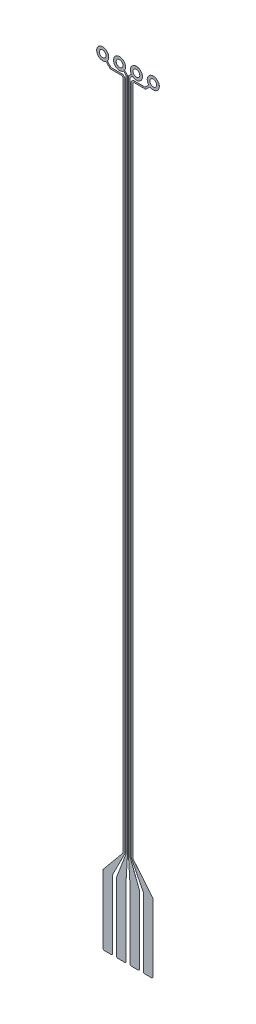
from build123d import *

# Parameters (mm, degrees)
BOSS_EXTRUDE1_DEPTH   = 0.001
BOSS_EXTRUDE1_2_DEPTH = 0.001
BOSS_EXTRUDE1_3_DEPTH = 0.001
BOSS_EXTRUDE1_4_DEPTH = 0.001


with BuildPart() as part:
    # Model → Boss-Extrude1 (new body)
    with BuildSketch(Plane.XY):
        Polygon((-0.925, -28.446), (-0.92475, -28.451), (-0.924, -28.45575), (-0.923, -28.4605), (-0.92125, -28.46525), (-0.919, -28.4695), (-0.9165, -28.47375), (-0.91375, -28.47775), (-0.9105, -28.4815), (-0.90675, -28.48475), (-0.90275, -28.4875), (-0.8985, -28.49), (-0.89425, -28.49225), (-0.8895, -28.494), (-0.88475, -28.495), (-0.88, -28.49575), (-0.875, -28.496), (-0.625, -28.496), (-0.62, -28.49575), (-0.61525, -28.495), (-0.6105, -28.494), (-0.60575, -28.49225), (-0.6015, -28.49), (-0.59725, -28.4875), (-0.59325, -28.48475), (-0.5895, -28.4815), (-0.58625, -28.47775), (-0.5835, -28.47375), (-0.581, -28.4695), (-0.57875, -28.46525), (-0.577, -28.4605), (-0.576, -28.45575), (-0.57525, -28.451), (-0.575, -28.446), (-0.575, -25.896), (-0.12, -24.996), (-0.12, 0.042426), (-0.192574, 0.115), (-0.632574, 0.115), (-0.771201, 0.253626), (-0.768, 0.2575), (-0.7635, 0.26325), (-0.75925, 0.26875), (-0.755, 0.275), (-0.751, 0.28125), (-0.74725, 0.2875), (-0.74375, 0.29375), (-0.74025, 0.3005), (-0.73725, 0.307), (-0.73425, 0.31375), (-0.7315, 0.32075), (-0.729, 0.32775), (-0.72675, 0.3345), (-0.72475, 0.34175), (-0.723, 0.34875), (-0.7215, 0.356), (-0.72, 0.3635), (-0.719, 0.3705), (-0.71825, 0.37775), (-0.7175, 0.38525), (-0.71725, 0.3925), (-0.717, 0.4), (-0.71725, 0.4075), (-0.7175, 0.41475), (-0.71825, 0.42225), (-0.719, 0.4295), (-0.72, 0.4365), (-0.7215, 0.444), (-0.723, 0.45125), (-0.72475, 0.45825), (-0.72675, 0.4655), (-0.729, 0.47225), (-0.7315, 0.47925), (-0.73425, 0.48625), (-0.73725, 0.493), (-0.74025, 0.4995), (-0.74375, 0.50625), (-0.74725, 0.5125), (-0.751, 0.51875), (-0.755, 0.525), (-0.75925, 0.53125), (-0.7635, 0.53675), (-0.768, 0.5425), (-0.77275, 0.54825), (-0.77775, 0.55375), (-0.78825, 0.56425), (-0.79375, 0.56925), (-0.7995, 0.574), (-0.80525, 0.5785), (-0.81075, 0.58275), (-0.817, 0.587), (-0.82325, 0.591), (-0.8295, 0.59475), (-0.83575, 0.59825), (-0.8425, 0.60175), (-0.849, 0.60475), (-0.85575, 0.60775), (-0.86275, 0.6105), (-0.86975, 0.613), (-0.8765, 0.61525), (-0.88375, 0.61725), (-0.89075, 0.619), (-0.898, 0.6205), (-0.9055, 0.622), (-0.9125, 0.623), (-0.91975, 0.62375), (-0.92725, 0.6245), (-0.9345, 0.62475), (-0.942, 0.625), (-0.9495, 0.62475), (-0.95675, 0.6245), (-0.96425, 0.62375), (-0.9715, 0.623), (-0.9785, 0.622), (-0.986, 0.6205), (-0.99325, 0.619), (-1.00025, 0.61725), (-1.0075, 0.61525), (-1.01425, 0.613), (-1.02125, 0.6105), (-1.02825, 0.60775), (-1.035, 0.60475), (-1.041, 0.601981), (-1.04825, 0.59825), (-1.0545, 0.59475), (-1.06075, 0.591), (-1.067, 0.587), (-1.07325, 0.58275), (-1.07875, 0.5785), (-1.0845, 0.574), (-1.09025, 0.56925), (-1.09575, 0.56425), (-1.10625, 0.55375), (-1.11125, 0.54825), (-1.116, 0.5425), (-1.1205, 0.53675), (-1.12475, 0.53125), (-1.129, 0.525), (-1.133, 0.51875), (-1.13675, 0.5125), (-1.14025, 0.50625), (-1.14375, 0.4995), (-1.14675, 0.493), (-1.14975, 0.48625), (-1.1525, 0.47925), (-1.155, 0.47225), (-1.15725, 0.4655), (-1.15925, 0.45825), (-1.161, 0.45125), (-1.1625, 0.444), (-1.164, 0.4365), (-1.165, 0.4295), (-1.16575, 0.42225), (-1.1665, 0.41475), (-1.16675, 0.4075), (-1.167, 0.4), (-1.16675, 0.3925), (-1.1665, 0.38525), (-1.16575, 0.37775), (-1.165, 0.3705), (-1.164, 0.3635), (-1.1625, 0.356), (-1.161, 0.34875), (-1.15925, 0.34175), (-1.15725, 0.3345), (-1.155, 0.32775), (-1.1525, 0.32075), (-1.14975, 0.31375), (-1.14675, 0.307), (-1.14375, 0.3005), (-1.14025, 0.29375), (-1.13675, 0.2875), (-1.133, 0.28125), (-1.129, 0.275), (-1.12475, 0.26875), (-1.1205, 0.26325), (-1.116, 0.2575), (-1.11125, 0.25175), (-1.10625, 0.24625), (-1.09575, 0.23575), (-1.09025, 0.23075), (-1.0845, 0.226), (-1.07875, 0.2215), (-1.07325, 0.21725), (-1.067, 0.213), (-1.06075, 0.209), (-1.0545, 0.20525), (-1.04825, 0.20175), (-1.0415, 0.19825), (-1.035, 0.19525), (-1.02825, 0.19225), (-1.02125, 0.1895), (-1.01425, 0.187), (-1.0075, 0.18475), (-1.00025, 0.18275), (-0.99325, 0.181), (-0.986, 0.1795), (-0.9785, 0.178), (-0.9715, 0.177), (-0.96425, 0.17625), (-0.95675, 0.1755), (-0.9495, 0.17525), (-0.942, 0.175), (-0.9345, 0.17525), (-0.92725, 0.1755), (-0.91975, 0.17625), (-0.9125, 0.177), (-0.9055, 0.178), (-0.898, 0.1795), (-0.89075, 0.181), (-0.88375, 0.18275), (-0.8765, 0.18475), (-0.86975, 0.187), (-0.86275, 0.1895), (-0.85575, 0.19225), (-0.849, 0.19525), (-0.8425, 0.19825), (-0.83575, 0.20175), (-0.8295, 0.20525), (-0.82325, 0.209), (-0.817, 0.213), (-0.816064, 0.213637), (-0.657426, 0.055), (-0.217426, 0.055), (-0.18, 0.017574), (-0.18, -24.996), (-0.925, -25.896), align=None)
        Polygon((-1.041, 0.47625), (-1.03775, 0.48025), (-1.03425, 0.48425), (-1.0305, 0.48825), (-1.02625, 0.49225), (-1.02225, 0.49575), (-1.01825, 0.499), (-1.0135, 0.5025), (-1.009, 0.5055), (-1.0045, 0.50825), (-0.99975, 0.51075), (-0.99475, 0.51325), (-0.98975, 0.5155), (-0.985, 0.51725), (-0.97975, 0.519), (-0.97425, 0.52075), (-0.969, 0.522), (-0.96375, 0.523), (-0.9585, 0.52375), (-0.953, 0.5245), (-0.942, 0.525), (-0.931, 0.5245), (-0.9255, 0.52375), (-0.92025, 0.523), (-0.915, 0.522), (-0.90975, 0.52075), (-0.90425, 0.519), (-0.899, 0.51725), (-0.89425, 0.5155), (-0.88925, 0.51325), (-0.88425, 0.51075), (-0.8795, 0.50825), (-0.875, 0.5055), (-0.8705, 0.5025), (-0.86575, 0.499), (-0.86175, 0.49575), (-0.85775, 0.49225), (-0.8535, 0.48825), (-0.84975, 0.48425), (-0.84625, 0.48025), (-0.843, 0.47625), (-0.8395, 0.4715), (-0.8365, 0.467), (-0.83375, 0.4625), (-0.83125, 0.45775), (-0.82875, 0.45275), (-0.8265, 0.44775), (-0.82475, 0.443), (-0.823, 0.43775), (-0.82125, 0.43225), (-0.82, 0.427), (-0.819, 0.42175), (-0.81825, 0.4165), (-0.8175, 0.411), (-0.817, 0.4), (-0.8175, 0.389), (-0.81825, 0.3835), (-0.819, 0.37825), (-0.82, 0.373), (-0.82125, 0.36775), (-0.823, 0.36225), (-0.82475, 0.357), (-0.8265, 0.35225), (-0.82875, 0.34725), (-0.83125, 0.34225), (-0.83375, 0.3375), (-0.8365, 0.333), (-0.8395, 0.3285), (-0.843, 0.32375), (-0.84625, 0.31975), (-0.84975, 0.31575), (-0.8535, 0.31175), (-0.85775, 0.30775), (-0.86175, 0.30425), (-0.86575, 0.301), (-0.8705, 0.2975), (-0.875, 0.2945), (-0.8795, 0.29175), (-0.88425, 0.28925), (-0.88925, 0.28675), (-0.89425, 0.2845), (-0.899, 0.28275), (-0.90425, 0.281), (-0.90975, 0.27925), (-0.915, 0.278), (-0.92025, 0.277), (-0.9255, 0.27625), (-0.931, 0.2755), (-0.942, 0.275), (-0.953, 0.2755), (-0.9585, 0.27625), (-0.96375, 0.277), (-0.969, 0.278), (-0.97425, 0.27925), (-0.97975, 0.281), (-0.985, 0.28275), (-0.98975, 0.2845), (-0.99475, 0.28675), (-0.99975, 0.28925), (-1.0045, 0.29175), (-1.009, 0.2945), (-1.0135, 0.2975), (-1.01825, 0.301), (-1.02225, 0.30425), (-1.02625, 0.30775), (-1.0305, 0.31175), (-1.03425, 0.31575), (-1.03775, 0.31975), (-1.041, 0.32375), (-1.0445, 0.3285), (-1.0475, 0.333), (-1.05025, 0.3375), (-1.05275, 0.34225), (-1.05525, 0.34725), (-1.0575, 0.35225), (-1.05925, 0.357), (-1.061, 0.36225), (-1.06275, 0.36775), (-1.064, 0.373), (-1.065, 0.37825), (-1.06575, 0.3835), (-1.0665, 0.389), (-1.067, 0.4), (-1.0665, 0.411), (-1.06575, 0.4165), (-1.065, 0.42175), (-1.064, 0.427), (-1.06275, 0.43225), (-1.061, 0.43775), (-1.05925, 0.443), (-1.0575, 0.44775), (-1.05525, 0.45275), (-1.05275, 0.45775), (-1.05025, 0.4625), (-1.0475, 0.467), (-1.0445, 0.4715), align=None, mode=Mode.SUBTRACT)
    extrude(amount=BOSS_EXTRUDE1_DEPTH)


with BuildPart() as body_2:
    # Model → Boss-Extrude1 2 (new body)
    with BuildSketch(Plane.XY):
        Polygon((-0.02, -24.996), (-0.02, 0.172426), (-0.125273, 0.277699), (-0.123, 0.28125), (-0.11925, 0.2875), (-0.11575, 0.29375), (-0.11225, 0.3005), (-0.10925, 0.307), (-0.10625, 0.31375), (-0.1035, 0.32075), (-0.101, 0.32775), (-0.09875, 0.3345), (-0.09675, 0.34175), (-0.095, 0.34875), (-0.0935, 0.356), (-0.092, 0.3635), (-0.091, 0.3705), (-0.09025, 0.37775), (-0.0895, 0.38525), (-0.08925, 0.3925), (-0.089, 0.4), (-0.08925, 0.4075), (-0.0895, 0.41475), (-0.09025, 0.42225), (-0.091, 0.4295), (-0.092, 0.4365), (-0.0935, 0.444), (-0.095, 0.45125), (-0.09675, 0.45825), (-0.09875, 0.4655), (-0.101, 0.47225), (-0.1035, 0.47925), (-0.10625, 0.48625), (-0.10925, 0.493), (-0.11225, 0.4995), (-0.11575, 0.50625), (-0.11925, 0.5125), (-0.123, 0.51875), (-0.127, 0.525), (-0.13125, 0.53125), (-0.1355, 0.53675), (-0.14, 0.5425), (-0.14475, 0.54825), (-0.14975, 0.55375), (-0.16025, 0.56425), (-0.16575, 0.56925), (-0.1715, 0.574), (-0.17725, 0.5785), (-0.18275, 0.58275), (-0.189, 0.587), (-0.19525, 0.591), (-0.2015, 0.59475), (-0.20775, 0.59825), (-0.2145, 0.60175), (-0.221, 0.60475), (-0.22775, 0.60775), (-0.23475, 0.6105), (-0.24175, 0.613), (-0.2485, 0.61525), (-0.25575, 0.61725), (-0.26275, 0.619), (-0.27, 0.6205), (-0.2775, 0.622), (-0.2845, 0.623), (-0.29175, 0.62375), (-0.29925, 0.6245), (-0.3065, 0.62475), (-0.314, 0.625), (-0.3215, 0.62475), (-0.32875, 0.6245), (-0.33625, 0.62375), (-0.3435, 0.623), (-0.3505, 0.622), (-0.358, 0.6205), (-0.36525, 0.619), (-0.37225, 0.61725), (-0.3795, 0.61525), (-0.38625, 0.613), (-0.39325, 0.6105), (-0.40025, 0.60775), (-0.407, 0.60475), (-0.4135, 0.60175), (-0.42025, 0.59825), (-0.4265, 0.59475), (-0.43275, 0.591), (-0.4385, 0.58732), (-0.44525, 0.58275), (-0.45075, 0.5785), (-0.4565, 0.574), (-0.46225, 0.56925), (-0.46775, 0.56425), (-0.47825, 0.55375), (-0.48325, 0.54825), (-0.488, 0.5425), (-0.4925, 0.53675), (-0.49675, 0.53125), (-0.501, 0.525), (-0.505, 0.51875), (-0.50875, 0.5125), (-0.51225, 0.50625), (-0.51575, 0.4995), (-0.51875, 0.493), (-0.52175, 0.48625), (-0.5245, 0.47925), (-0.527, 0.47225), (-0.52925, 0.4655), (-0.53125, 0.45825), (-0.533, 0.45125), (-0.5345, 0.444), (-0.536, 0.4365), (-0.537, 0.4295), (-0.53775, 0.42225), (-0.5385, 0.41475), (-0.53875, 0.4075), (-0.539, 0.4), (-0.53875, 0.3925), (-0.5385, 0.38525), (-0.53775, 0.37775), (-0.537, 0.3705), (-0.536, 0.3635), (-0.5345, 0.356), (-0.533, 0.34875), (-0.53125, 0.34175), (-0.52925, 0.3345), (-0.527, 0.32775), (-0.5245, 0.32075), (-0.52175, 0.31375), (-0.51875, 0.307), (-0.51575, 0.3005), (-0.51225, 0.29375), (-0.50875, 0.2875), (-0.505, 0.28125), (-0.501, 0.275), (-0.49675, 0.26875), (-0.4925, 0.26325), (-0.488, 0.2575), (-0.48325, 0.25175), (-0.47825, 0.24625), (-0.46775, 0.23575), (-0.46225, 0.23075), (-0.4565, 0.226), (-0.45075, 0.2215), (-0.44525, 0.21725), (-0.439, 0.213), (-0.43275, 0.209), (-0.4265, 0.20525), (-0.42025, 0.20175), (-0.4135, 0.19825), (-0.407, 0.19525), (-0.40025, 0.19225), (-0.39325, 0.1895), (-0.38625, 0.187), (-0.3795, 0.18475), (-0.37225, 0.18275), (-0.36525, 0.181), (-0.358, 0.1795), (-0.3505, 0.178), (-0.3435, 0.177), (-0.33625, 0.17625), (-0.32875, 0.1755), (-0.3215, 0.17525), (-0.314, 0.175), (-0.3065, 0.17525), (-0.29925, 0.1755), (-0.29175, 0.17625), (-0.2845, 0.177), (-0.2775, 0.178), (-0.27, 0.1795), (-0.26275, 0.181), (-0.25575, 0.18275), (-0.2485, 0.18475), (-0.24175, 0.187), (-0.23475, 0.1895), (-0.22775, 0.19225), (-0.221, 0.19525), (-0.2145, 0.19825), (-0.20775, 0.20175), (-0.2015, 0.20525), (-0.19525, 0.209), (-0.189, 0.213), (-0.18275, 0.21725), (-0.17725, 0.2215), (-0.1715, 0.226), (-0.16575, 0.23075), (-0.164402, 0.231976), (-0.08, 0.147574), (-0.08, -24.996), (-0.425, -25.896), (-0.425, -28.446), (-0.42475, -28.451), (-0.424, -28.45575), (-0.423, -28.4605), (-0.42125, -28.46525), (-0.419, -28.4695), (-0.4165, -28.47375), (-0.41375, -28.47775), (-0.4105, -28.4815), (-0.40675, -28.48475), (-0.40275, -28.4875), (-0.3985, -28.49), (-0.39425, -28.49225), (-0.3895, -28.494), (-0.38475, -28.495), (-0.38, -28.49575), (-0.375, -28.496), (-0.125, -28.496), (-0.12, -28.49575), (-0.11525, -28.495), (-0.1105, -28.494), (-0.10575, -28.49225), (-0.1015, -28.49), (-0.09725, -28.4875), (-0.09325, -28.48475), (-0.0895, -28.4815), (-0.08625, -28.47775), (-0.0835, -28.47375), (-0.081, -28.4695), (-0.07875, -28.46525), (-0.077, -28.4605), (-0.076, -28.45575), (-0.07525, -28.451), (-0.075, -28.446), (-0.075, -25.896), align=None)
        Polygon((-0.4385, 0.411), (-0.43775, 0.4165), (-0.437, 0.42175), (-0.436, 0.427), (-0.43475, 0.43225), (-0.433, 0.43775), (-0.43125, 0.443), (-0.4295, 0.44775), (-0.42725, 0.45275), (-0.42475, 0.45775), (-0.42225, 0.4625), (-0.4195, 0.467), (-0.4165, 0.4715), (-0.413, 0.47625), (-0.40975, 0.48025), (-0.40625, 0.48425), (-0.4025, 0.48825), (-0.39825, 0.49225), (-0.39425, 0.49575), (-0.39025, 0.499), (-0.3855, 0.5025), (-0.381, 0.5055), (-0.3765, 0.50825), (-0.37175, 0.51075), (-0.36675, 0.51325), (-0.36175, 0.5155), (-0.357, 0.51725), (-0.35175, 0.519), (-0.34625, 0.52075), (-0.341, 0.522), (-0.33575, 0.523), (-0.3305, 0.52375), (-0.325, 0.5245), (-0.314, 0.525), (-0.303, 0.5245), (-0.2975, 0.52375), (-0.29225, 0.523), (-0.287, 0.522), (-0.28175, 0.52075), (-0.27625, 0.519), (-0.271, 0.51725), (-0.26625, 0.5155), (-0.26125, 0.51325), (-0.25625, 0.51075), (-0.2515, 0.50825), (-0.247, 0.5055), (-0.2425, 0.5025), (-0.23775, 0.499), (-0.23375, 0.49575), (-0.22975, 0.49225), (-0.2255, 0.48825), (-0.22175, 0.48425), (-0.21825, 0.48025), (-0.215, 0.47625), (-0.2115, 0.4715), (-0.2085, 0.467), (-0.20575, 0.4625), (-0.20325, 0.45775), (-0.20075, 0.45275), (-0.1985, 0.44775), (-0.19675, 0.443), (-0.195, 0.43775), (-0.19325, 0.43225), (-0.192, 0.427), (-0.191, 0.42175), (-0.19025, 0.4165), (-0.1895, 0.411), (-0.189, 0.4), (-0.1895, 0.389), (-0.19025, 0.3835), (-0.191, 0.37825), (-0.192, 0.373), (-0.19325, 0.36775), (-0.195, 0.36225), (-0.19675, 0.357), (-0.1985, 0.35225), (-0.20075, 0.34725), (-0.20325, 0.34225), (-0.20575, 0.3375), (-0.2085, 0.333), (-0.2115, 0.3285), (-0.215, 0.32375), (-0.21825, 0.31975), (-0.22175, 0.31575), (-0.2255, 0.31175), (-0.22975, 0.30775), (-0.23375, 0.30425), (-0.23775, 0.301), (-0.2425, 0.2975), (-0.247, 0.2945), (-0.2515, 0.29175), (-0.25625, 0.28925), (-0.26125, 0.28675), (-0.26625, 0.2845), (-0.271, 0.28275), (-0.27625, 0.281), (-0.28175, 0.27925), (-0.287, 0.278), (-0.29225, 0.277), (-0.2975, 0.27625), (-0.303, 0.2755), (-0.314, 0.275), (-0.325, 0.2755), (-0.3305, 0.27625), (-0.33575, 0.277), (-0.341, 0.278), (-0.34625, 0.27925), (-0.35175, 0.281), (-0.357, 0.28275), (-0.36175, 0.2845), (-0.36675, 0.28675), (-0.37175, 0.28925), (-0.3765, 0.29175), (-0.381, 0.2945), (-0.3855, 0.2975), (-0.39025, 0.301), (-0.39425, 0.30425), (-0.39825, 0.30775), (-0.4025, 0.31175), (-0.40625, 0.31575), (-0.40975, 0.31975), (-0.413, 0.32375), (-0.4165, 0.3285), (-0.4195, 0.333), (-0.42225, 0.3375), (-0.42475, 0.34225), (-0.42725, 0.34725), (-0.4295, 0.35225), (-0.43125, 0.357), (-0.433, 0.36225), (-0.43475, 0.36775), (-0.436, 0.373), (-0.437, 0.37825), (-0.43775, 0.3835), (-0.4385, 0.389), (-0.439, 0.4), align=None, mode=Mode.SUBTRACT)
    extrude(amount=BOSS_EXTRUDE1_2_DEPTH)


with BuildPart() as body_3:
    # Model → Boss-Extrude1 3 (new body)
    with BuildSketch(Plane.XY):
        Polygon((0.08, -24.996), (0.08, 0.145), (0.16575, 0.23075), (0.1715, 0.226), (0.17725, 0.2215), (0.18275, 0.21725), (0.189, 0.213), (0.19525, 0.209), (0.2015, 0.20525), (0.20775, 0.20175), (0.2145, 0.19825), (0.221, 0.19525), (0.22775, 0.19225), (0.23475, 0.1895), (0.24175, 0.187), (0.2485, 0.18475), (0.25575, 0.18275), (0.26275, 0.181), (0.27, 0.1795), (0.2775, 0.178), (0.2845, 0.177), (0.29175, 0.17625), (0.29925, 0.1755), (0.3065, 0.17525), (0.314, 0.175), (0.3215, 0.17525), (0.32875, 0.1755), (0.33625, 0.17625), (0.3435, 0.177), (0.3505, 0.178), (0.358, 0.1795), (0.36525, 0.181), (0.37225, 0.18275), (0.3795, 0.18475), (0.38625, 0.187), (0.39325, 0.1895), (0.40025, 0.19225), (0.407, 0.19525), (0.4135, 0.19825), (0.42025, 0.20175), (0.4265, 0.20525), (0.43275, 0.209), (0.439, 0.213), (0.44525, 0.21725), (0.45075, 0.2215), (0.4565, 0.226), (0.46225, 0.23075), (0.46775, 0.23575), (0.47825, 0.24625), (0.48325, 0.25175), (0.488, 0.2575), (0.4925, 0.26325), (0.49675, 0.26875), (0.501, 0.275), (0.505, 0.28125), (0.50875, 0.2875), (0.51225, 0.29375), (0.51575, 0.3005), (0.51875, 0.307), (0.52175, 0.31375), (0.5245, 0.32075), (0.527, 0.32775), (0.52925, 0.3345), (0.53125, 0.34175), (0.533, 0.34875), (0.5345, 0.356), (0.536, 0.3635), (0.537, 0.3705), (0.53775, 0.37775), (0.5385, 0.38525), (0.53875, 0.3925), (0.539, 0.4), (0.53875, 0.4075), (0.5385, 0.41475), (0.53775, 0.42225), (0.537, 0.4295), (0.536, 0.4365), (0.5345, 0.444), (0.533, 0.45125), (0.53125, 0.45825), (0.52925, 0.4655), (0.527, 0.47225), (0.5245, 0.47925), (0.52175, 0.48625), (0.51875, 0.493), (0.51575, 0.4995), (0.51225, 0.50625), (0.50875, 0.5125), (0.505, 0.51875), (0.501, 0.525), (0.49675, 0.53125), (0.4925, 0.53675), (0.488, 0.5425), (0.48325, 0.54825), (0.47825, 0.55375), (0.46775, 0.56425), (0.46225, 0.56925), (0.4565, 0.574), (0.45075, 0.5785), (0.44525, 0.58275), (0.439, 0.587), (0.43275, 0.591), (0.4265, 0.59475), (0.42025, 0.59825), (0.4135, 0.60175), (0.407, 0.60475), (0.40025, 0.60775), (0.39325, 0.6105), (0.38625, 0.613), (0.3795, 0.61525), (0.37225, 0.61725), (0.36525, 0.619), (0.358, 0.6205), (0.3505, 0.622), (0.3435, 0.623), (0.33625, 0.62375), (0.32875, 0.6245), (0.3215, 0.62475), (0.314, 0.625), (0.3065, 0.62475), (0.29925, 0.6245), (0.29175, 0.62375), (0.2845, 0.623), (0.2775, 0.622), (0.27, 0.6205), (0.26275, 0.619), (0.25575, 0.61725), (0.2485, 0.61525), (0.24175, 0.613), (0.23475, 0.6105), (0.22775, 0.60775), (0.221, 0.60475), (0.2145, 0.60175), (0.20775, 0.59825), (0.2015, 0.59475), (0.19525, 0.591), (0.1895, 0.58732), (0.18275, 0.58275), (0.17725, 0.5785), (0.1715, 0.574), (0.16575, 0.56925), (0.16025, 0.56425), (0.14975, 0.55375), (0.14475, 0.54825), (0.14, 0.5425), (0.1355, 0.53675), (0.13125, 0.53125), (0.127, 0.525), (0.123, 0.51875), (0.11925, 0.5125), (0.11575, 0.50625), (0.11225, 0.4995), (0.10925, 0.493), (0.10625, 0.48625), (0.1035, 0.47925), (0.101, 0.47225), (0.09875, 0.4655), (0.09675, 0.45825), (0.095, 0.45125), (0.0935, 0.444), (0.092, 0.4365), (0.091, 0.4295), (0.09025, 0.42225), (0.0895, 0.41475), (0.08925, 0.4075), (0.089, 0.4), (0.08925, 0.3925), (0.0895, 0.38525), (0.09025, 0.37775), (0.091, 0.3705), (0.092, 0.3635), (0.0935, 0.356), (0.095, 0.34875), (0.09675, 0.34175), (0.09875, 0.3345), (0.101, 0.32775), (0.1035, 0.32075), (0.10625, 0.31375), (0.10925, 0.307), (0.11225, 0.3005), (0.11575, 0.29375), (0.11925, 0.2875), (0.123, 0.28125), (0.126277, 0.276129), (0.02, 0.169852), (0.02, -24.996), (0.075, -25.896), (0.075, -28.446), (0.07525, -28.451), (0.076, -28.45575), (0.077, -28.4605), (0.07875, -28.46525), (0.081, -28.4695), (0.0835, -28.47375), (0.08625, -28.47775), (0.0895, -28.4815), (0.09325, -28.48475), (0.09725, -28.4875), (0.1015, -28.49), (0.10575, -28.49225), (0.1105, -28.494), (0.11525, -28.495), (0.12, -28.49575), (0.125, -28.496), (0.375, -28.496), (0.38, -28.49575), (0.38475, -28.495), (0.3895, -28.494), (0.39425, -28.49225), (0.3985, -28.49), (0.40275, -28.4875), (0.40675, -28.48475), (0.4105, -28.4815), (0.41375, -28.47775), (0.4165, -28.47375), (0.419, -28.4695), (0.42125, -28.46525), (0.423, -28.4605), (0.424, -28.45575), (0.42475, -28.451), (0.425, -28.446), (0.425, -25.896), align=None)
        Polygon((0.1895, 0.411), (0.19025, 0.4165), (0.191, 0.42175), (0.192, 0.427), (0.19325, 0.43225), (0.195, 0.43775), (0.19675, 0.443), (0.1985, 0.44775), (0.20075, 0.45275), (0.20325, 0.45775), (0.20575, 0.4625), (0.2085, 0.467), (0.2115, 0.4715), (0.215, 0.47625), (0.21825, 0.48025), (0.22175, 0.48425), (0.2255, 0.48825), (0.22975, 0.49225), (0.23375, 0.49575), (0.23775, 0.499), (0.2425, 0.5025), (0.247, 0.5055), (0.2515, 0.50825), (0.25625, 0.51075), (0.26125, 0.51325), (0.26625, 0.5155), (0.271, 0.51725), (0.27625, 0.519), (0.28175, 0.52075), (0.287, 0.522), (0.29225, 0.523), (0.2975, 0.52375), (0.303, 0.5245), (0.314, 0.525), (0.325, 0.5245), (0.3305, 0.52375), (0.33575, 0.523), (0.341, 0.522), (0.34625, 0.52075), (0.35175, 0.519), (0.357, 0.51725), (0.36175, 0.5155), (0.36675, 0.51325), (0.37175, 0.51075), (0.3765, 0.50825), (0.381, 0.5055), (0.3855, 0.5025), (0.39025, 0.499), (0.39425, 0.49575), (0.39825, 0.49225), (0.4025, 0.48825), (0.40625, 0.48425), (0.40975, 0.48025), (0.413, 0.47625), (0.4165, 0.4715), (0.4195, 0.467), (0.42225, 0.4625), (0.42475, 0.45775), (0.42725, 0.45275), (0.4295, 0.44775), (0.43125, 0.443), (0.433, 0.43775), (0.43475, 0.43225), (0.436, 0.427), (0.437, 0.42175), (0.43775, 0.4165), (0.4385, 0.411), (0.439, 0.4), (0.4385, 0.389), (0.43775, 0.3835), (0.437, 0.37825), (0.436, 0.373), (0.43475, 0.36775), (0.433, 0.36225), (0.43125, 0.357), (0.4295, 0.35225), (0.42725, 0.34725), (0.42475, 0.34225), (0.42225, 0.3375), (0.4195, 0.333), (0.4165, 0.3285), (0.413, 0.32375), (0.40975, 0.31975), (0.40625, 0.31575), (0.4025, 0.31175), (0.39825, 0.30775), (0.39425, 0.30425), (0.39025, 0.301), (0.3855, 0.2975), (0.381, 0.2945), (0.3765, 0.29175), (0.37175, 0.28925), (0.36675, 0.28675), (0.36175, 0.2845), (0.357, 0.28275), (0.35175, 0.281), (0.34625, 0.27925), (0.341, 0.278), (0.33575, 0.277), (0.3305, 0.27625), (0.325, 0.2755), (0.314, 0.275), (0.303, 0.2755), (0.2975, 0.27625), (0.29225, 0.277), (0.287, 0.278), (0.28175, 0.27925), (0.27625, 0.281), (0.271, 0.28275), (0.26625, 0.2845), (0.26125, 0.28675), (0.25625, 0.28925), (0.2515, 0.29175), (0.247, 0.2945), (0.2425, 0.2975), (0.23775, 0.301), (0.23375, 0.30425), (0.22975, 0.30775), (0.2255, 0.31175), (0.22175, 0.31575), (0.21825, 0.31975), (0.215, 0.32375), (0.2115, 0.3285), (0.2085, 0.333), (0.20575, 0.3375), (0.20325, 0.34225), (0.20075, 0.34725), (0.1985, 0.35225), (0.19675, 0.357), (0.195, 0.36225), (0.19325, 0.36775), (0.192, 0.373), (0.191, 0.37825), (0.19025, 0.3835), (0.1895, 0.389), (0.189, 0.4), align=None, mode=Mode.SUBTRACT)
    extrude(amount=BOSS_EXTRUDE1_3_DEPTH)


with BuildPart() as body_4:
    # Model → Boss-Extrude1 4 (new body)
    with BuildSketch(Plane.XY):
        Polygon((0.18, -24.996), (0.18, 0.015), (0.22, 0.055), (0.66, 0.055), (0.817609, 0.21261), (0.82325, 0.209), (0.8295, 0.20525), (0.83575, 0.20175), (0.8425, 0.19825), (0.849, 0.19525), (0.85575, 0.19225), (0.86275, 0.1895), (0.86975, 0.187), (0.8765, 0.18475), (0.88375, 0.18275), (0.89075, 0.181), (0.898, 0.1795), (0.9055, 0.178), (0.9125, 0.177), (0.91975, 0.17625), (0.92725, 0.1755), (0.9345, 0.17525), (0.942, 0.175), (0.9495, 0.17525), (0.95675, 0.1755), (0.96425, 0.17625), (0.9715, 0.177), (0.9785, 0.178), (0.986, 0.1795), (0.99325, 0.181), (1.00025, 0.18275), (1.0075, 0.18475), (1.01425, 0.187), (1.02125, 0.1895), (1.02825, 0.19225), (1.035, 0.19525), (1.0415, 0.19825), (1.04825, 0.20175), (1.0545, 0.20525), (1.06075, 0.209), (1.067, 0.213), (1.07325, 0.21725), (1.07875, 0.2215), (1.0845, 0.226), (1.09025, 0.23075), (1.09575, 0.23575), (1.10625, 0.24625), (1.11125, 0.25175), (1.116, 0.2575), (1.1205, 0.26325), (1.12475, 0.26875), (1.129, 0.275), (1.133, 0.28125), (1.13675, 0.2875), (1.14025, 0.29375), (1.14375, 0.3005), (1.14675, 0.307), (1.14975, 0.31375), (1.1525, 0.32075), (1.155, 0.32775), (1.15725, 0.3345), (1.15925, 0.34175), (1.161, 0.34875), (1.1625, 0.356), (1.164, 0.3635), (1.165, 0.3705), (1.16575, 0.37775), (1.1665, 0.38525), (1.16675, 0.3925), (1.167, 0.4), (1.16675, 0.4075), (1.1665, 0.41475), (1.16575, 0.42225), (1.165, 0.4295), (1.164, 0.4365), (1.1625, 0.444), (1.161, 0.45125), (1.15925, 0.45825), (1.15725, 0.4655), (1.155, 0.47225), (1.1525, 0.47925), (1.14975, 0.48625), (1.14675, 0.493), (1.14375, 0.4995), (1.14025, 0.50625), (1.13675, 0.5125), (1.133, 0.51875), (1.129, 0.525), (1.12475, 0.53125), (1.1205, 0.53675), (1.116, 0.5425), (1.11125, 0.54825), (1.10625, 0.55375), (1.09575, 0.56425), (1.09025, 0.56925), (1.0845, 0.574), (1.07875, 0.5785), (1.07325, 0.58275), (1.067, 0.587), (1.06075, 0.591), (1.0545, 0.59475), (1.04825, 0.59825), (1.0415, 0.60175), (1.035, 0.60475), (1.02825, 0.60775), (1.02125, 0.6105), (1.01425, 0.613), (1.0075, 0.61525), (1.00025, 0.61725), (0.99325, 0.619), (0.986, 0.6205), (0.9785, 0.622), (0.9715, 0.623), (0.96425, 0.62375), (0.95675, 0.6245), (0.9495, 0.62475), (0.942, 0.625), (0.9345, 0.62475), (0.92725, 0.6245), (0.91975, 0.62375), (0.9125, 0.623), (0.9055, 0.622), (0.898, 0.6205), (0.89075, 0.619), (0.88375, 0.61725), (0.8765, 0.61525), (0.86975, 0.613), (0.86275, 0.6105), (0.85575, 0.60775), (0.849, 0.60475), (0.843, 0.601981), (0.83575, 0.59825), (0.8295, 0.59475), (0.82325, 0.591), (0.817, 0.587), (0.81075, 0.58275), (0.80525, 0.5785), (0.7995, 0.574), (0.79375, 0.56925), (0.78825, 0.56425), (0.77775, 0.55375), (0.77275, 0.54825), (0.768, 0.5425), (0.7635, 0.53675), (0.75925, 0.53125), (0.755, 0.525), (0.751, 0.51875), (0.74725, 0.5125), (0.74375, 0.50625), (0.74025, 0.4995), (0.73725, 0.493), (0.73425, 0.48625), (0.7315, 0.47925), (0.729, 0.47225), (0.72675, 0.4655), (0.72475, 0.45825), (0.723, 0.45125), (0.7215, 0.444), (0.72, 0.4365), (0.719, 0.4295), (0.71825, 0.42225), (0.7175, 0.41475), (0.71725, 0.4075), (0.717, 0.4), (0.71725, 0.3925), (0.7175, 0.38525), (0.71825, 0.37775), (0.719, 0.3705), (0.72, 0.3635), (0.7215, 0.356), (0.723, 0.34875), (0.72475, 0.34175), (0.72675, 0.3345), (0.729, 0.32775), (0.7315, 0.32075), (0.73425, 0.31375), (0.73725, 0.307), (0.74025, 0.3005), (0.74375, 0.29375), (0.74725, 0.2875), (0.751, 0.28125), (0.755, 0.275), (0.75925, 0.26875), (0.7635, 0.26325), (0.768, 0.2575), (0.772364, 0.252217), (0.635148, 0.115), (0.195148, 0.115), (0.12, 0.039852), (0.12, -24.996), (0.575, -25.896), (0.575, -28.446), (0.57525, -28.451), (0.576, -28.45575), (0.577, -28.4605), (0.57875, -28.46525), (0.581, -28.4695), (0.5835, -28.47375), (0.58625, -28.47775), (0.5895, -28.4815), (0.59325, -28.48475), (0.59725, -28.4875), (0.6015, -28.49), (0.60575, -28.49225), (0.6105, -28.494), (0.61525, -28.495), (0.62, -28.49575), (0.625, -28.496), (0.875, -28.496), (0.88, -28.49575), (0.88475, -28.495), (0.8895, -28.494), (0.89425, -28.49225), (0.8985, -28.49), (0.90275, -28.4875), (0.90675, -28.48475), (0.9105, -28.4815), (0.91375, -28.47775), (0.9165, -28.47375), (0.919, -28.4695), (0.92125, -28.46525), (0.923, -28.4605), (0.924, -28.45575), (0.92475, -28.451), (0.925, -28.446), (0.925, -25.896), align=None)
        Polygon((0.843, 0.47625), (0.84625, 0.48025), (0.84975, 0.48425), (0.8535, 0.48825), (0.85775, 0.49225), (0.86175, 0.49575), (0.86575, 0.499), (0.8705, 0.5025), (0.875, 0.5055), (0.8795, 0.50825), (0.88425, 0.51075), (0.88925, 0.51325), (0.89425, 0.5155), (0.899, 0.51725), (0.90425, 0.519), (0.90975, 0.52075), (0.915, 0.522), (0.92025, 0.523), (0.9255, 0.52375), (0.931, 0.5245), (0.942, 0.525), (0.953, 0.5245), (0.9585, 0.52375), (0.96375, 0.523), (0.969, 0.522), (0.97425, 0.52075), (0.97975, 0.519), (0.985, 0.51725), (0.98975, 0.5155), (0.99475, 0.51325), (0.99975, 0.51075), (1.0045, 0.50825), (1.009, 0.5055), (1.0135, 0.5025), (1.01825, 0.499), (1.02225, 0.49575), (1.02625, 0.49225), (1.0305, 0.48825), (1.03425, 0.48425), (1.03775, 0.48025), (1.041, 0.47625), (1.0445, 0.4715), (1.0475, 0.467), (1.05025, 0.4625), (1.05275, 0.45775), (1.05525, 0.45275), (1.0575, 0.44775), (1.05925, 0.443), (1.061, 0.43775), (1.06275, 0.43225), (1.064, 0.427), (1.065, 0.42175), (1.06575, 0.4165), (1.0665, 0.411), (1.067, 0.4), (1.0665, 0.389), (1.06575, 0.3835), (1.065, 0.37825), (1.064, 0.373), (1.06275, 0.36775), (1.061, 0.36225), (1.05925, 0.357), (1.0575, 0.35225), (1.05525, 0.34725), (1.05275, 0.34225), (1.05025, 0.3375), (1.0475, 0.333), (1.0445, 0.3285), (1.041, 0.32375), (1.03775, 0.31975), (1.03425, 0.31575), (1.0305, 0.31175), (1.02625, 0.30775), (1.02225, 0.30425), (1.01825, 0.301), (1.0135, 0.2975), (1.009, 0.2945), (1.0045, 0.29175), (0.99975, 0.28925), (0.99475, 0.28675), (0.98975, 0.2845), (0.985, 0.28275), (0.97975, 0.281), (0.97425, 0.27925), (0.969, 0.278), (0.96375, 0.277), (0.9585, 0.27625), (0.953, 0.2755), (0.942, 0.275), (0.931, 0.2755), (0.9255, 0.27625), (0.92025, 0.277), (0.915, 0.278), (0.90975, 0.27925), (0.90425, 0.281), (0.899, 0.28275), (0.89425, 0.2845), (0.88925, 0.28675), (0.88425, 0.28925), (0.8795, 0.29175), (0.875, 0.2945), (0.8705, 0.2975), (0.86575, 0.301), (0.86175, 0.30425), (0.85775, 0.30775), (0.8535, 0.31175), (0.84975, 0.31575), (0.84625, 0.31975), (0.843, 0.32375), (0.8395, 0.3285), (0.8365, 0.333), (0.83375, 0.3375), (0.83125, 0.34225), (0.82875, 0.34725), (0.8265, 0.35225), (0.82475, 0.357), (0.823, 0.36225), (0.82125, 0.36775), (0.82, 0.373), (0.819, 0.37825), (0.81825, 0.3835), (0.8175, 0.389), (0.817, 0.4), (0.8175, 0.411), (0.81825, 0.4165), (0.819, 0.42175), (0.82, 0.427), (0.82125, 0.43225), (0.823, 0.43775), (0.82475, 0.443), (0.8265, 0.44775), (0.82875, 0.45275), (0.83125, 0.45775), (0.83375, 0.4625), (0.8365, 0.467), (0.8395, 0.4715), align=None, mode=Mode.SUBTRACT)
    extrude(amount=BOSS_EXTRUDE1_4_DEPTH)


solid = Compound([part.part, body_2.part, body_3.part, body_4.part])
